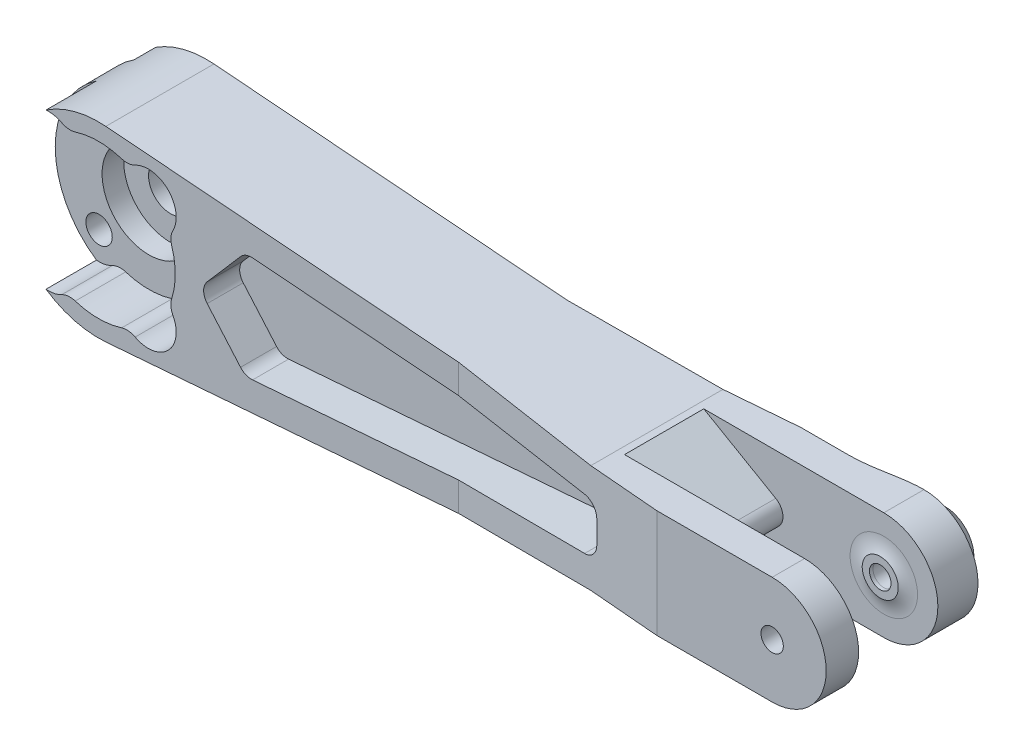
from build123d import *

# Parameters (mm, degrees)
SKETCH2_R               = 13
SKETCH2_R_2             = 7.5
BOSS_EXTRUDE2_DEPTH     = 10
CUT_EXTRUDE1_DEPTH      = 105.791459576
CUT_EXTRUDE1_DEPTH_BACK = 105.791459576
SKETCH5_R               = 1.83
SKETCH5_R_2             = 3.05
CUT_EXTRUDE2_DEPTH      = 106.770979007
HUB_CUTOUT_DEPTH        = 7
SKETCH8_R               = 6.5
CUT_EXTRUDE4_DEPTH      = 3
CUT_EXTRUDE5_DEPTH      = 105.791459576
CUT_EXTRUDE5_DEPTH_BACK = 105.791459576
SKETCH9_R               = 1.55
CUT_EXTRUDE6_DEPTH      = 5.5
FILLET1_R               = 2
CUT_EXTRUDE7_START      = 2.5
CUT_EXTRUDE7_DEPTH      = 103.291459576
FILLET2_R               = 2
FILLET2_OF_MIRROR1_R    = 2
SKETCH12_R              = 4
SKETCH12_R_2            = 1.55
BOSS_EXTRUDE3_DEPTH     = 4
FILLET3_START           = -14
FILLET3_2_DEPTH         = 4
BOSS_EXTRUDE4_START     = 5.5
SKETCH13_R              = 2.5
SKETCH13_R_2            = 1.5
BOSS_EXTRUDE4_DEPTH     = 0.5
BOSS_EXTRUDE5_START     = -5
SKETCH13_2_R            = 2.5
SKETCH13_2_R_2          = 1.5
BOSS_EXTRUDE5_DEPTH     = 0.5
FILLET4_R               = 5
SKETCH15_R              = 4
CUT_EXTRUDE8_DEPTH      = 3


with BuildPart() as part:
    # Sketch2 → Boss-Extrude2 (new, symmetric)
    with BuildSketch(Plane.XY):
        Circle(SKETCH2_R)
        with BuildLine():
            Line((70, 7.5), (1.025771359, 12.959467316))
            ThreePointArc((1.025771359, 12.959467316), (9.548168088, 8.822272166), (13, 0))
            ThreePointArc((13, 0), (9.548168088, -8.822272166), (1.025771359, -12.959467316))
            Line((1.025771359, -12.959467316), (70, -7.5))
            Line((70, -7.5), (70, 7.5))
        make_face()
        with BuildLine():
            Line((96, 7.5), (70, 7.5))
            Line((70, 7.5), (70, -7.5))
            Line((70, -7.5), (96, -7.5))
            ThreePointArc((96, -7.5), (88.5, 0), (96, 7.5))
        make_face()
        with Locations((96, 0)):
            Circle(SKETCH2_R_2)
        Circle(SKETCH2_R)
    extrude(amount=BOSS_EXTRUDE2_DEPTH, both=True)

    # Sketch4 → Cut-Extrude1 (cut, two sides: drawn at the far end of the back side and taken through both)
    with BuildSketch(Plane(origin=(0, 0, 0), x_dir=(1, 0, 0), z_dir=(0, 1, 0)).offset(-CUT_EXTRUDE1_DEPTH_BACK)):
        Polygon((-13, 7.5), (50, 7.5), (80, 10), (-13, 10), align=None)
        Polygon((-13, -7.5), (50, -7.5), (80, -10), (-13, -10), align=None)
    extrude(amount=CUT_EXTRUDE1_DEPTH + CUT_EXTRUDE1_DEPTH_BACK, mode=Mode.SUBTRACT)

    # Sketch5 → Cut-Extrude2 (cut, through all)
    with BuildSketch(Plane.XY.offset(7.5)):
        with Locations((-6.914797213, 6.914797213)):
            Circle(SKETCH5_R)
        with Locations((6.914797213, 6.914797213)):
            Circle(SKETCH5_R)
        with Locations((6.914797213, -6.914797213)):
            Circle(SKETCH5_R)
        with Locations((-6.914797213, -6.914797213)):
            Circle(SKETCH5_R)
        Circle(SKETCH5_R_2)
    extrude(amount=-CUT_EXTRUDE2_DEPTH, mode=Mode.SUBTRACT)

    # Sketch7 → hub cutout (cut)
    with BuildSketch(Plane.XY.offset(7.5)):
        with BuildLine():
            ThreePointArc((-7.281143007, 10.769631215), (-13, 0), (-7.281143007, -10.769631215))
            ThreePointArc((-7.281143007, -10.769631215), (-6.15529138, -10.711783559), (-5.093815501, -10.332103173))
            ThreePointArc((-5.093815501, -10.332103173), (-4.17580433, -10.057753531), (-3.223255475, -10.161014917))
            ThreePointArc((-3.223255475, -10.161014917), (0, -10.66), (3.223255475, -10.161014917))
            ThreePointArc((3.223255475, -10.161014917), (4.17580433, -10.057753531), (5.093815501, -10.332103173))
            ThreePointArc((5.093815501, -10.332103173), (9.652858062, -9.652858062), (10.332103173, -5.093815501))
            ThreePointArc((10.332103173, -5.093815501), (10.057753531, -4.17580433), (10.161014917, -3.223255475))
            ThreePointArc((10.161014917, -3.223255475), (10.66, 0), (10.161014917, 3.223255475))
            ThreePointArc((10.161014917, 3.223255475), (10.057753531, 4.17580433), (10.332103173, 5.093815501))
            ThreePointArc((10.332103173, 5.093815501), (9.652858062, 9.652858062), (5.093815501, 10.332103173))
            ThreePointArc((5.093815501, 10.332103173), (4.17580433, 10.057753531), (3.223255475, 10.161014917))
            ThreePointArc((3.223255475, 10.161014917), (0, 10.66), (-3.223255475, 10.161014917))
            ThreePointArc((-3.223255475, 10.161014917), (-4.17580433, 10.057753531), (-5.093815501, 10.332103173))
            ThreePointArc((-5.093815501, 10.332103173), (-6.15529138, 10.711783559), (-7.281143007, 10.769631215))
        make_face()
    extrude(amount=-HUB_CUTOUT_DEPTH, mode=Mode.SUBTRACT)

    # Sketch8 → Cut-Extrude4 (cut)
    with BuildSketch(Plane.XY.offset(0.5)):
        Circle(SKETCH8_R)
    extrude(amount=-CUT_EXTRUDE4_DEPTH, mode=Mode.SUBTRACT)

    # Sketch9 → Cut-Extrude5 (cut, two sides: drawn at the far end of the back side and taken through both)
    with BuildSketch(Plane.XY.offset(-CUT_EXTRUDE5_DEPTH_BACK)):
        with Locations((96, 0)):
            Circle(SKETCH9_R)
    extrude(amount=CUT_EXTRUDE5_DEPTH + CUT_EXTRUDE5_DEPTH_BACK, mode=Mode.SUBTRACT)

    # Sketch10 → Cut-Extrude6 (cut, symmetric)
    with BuildSketch(Plane.XY):
        Polygon((84, 0), (62.184725581, 12.595054558), (110.068063566, 12.595054558), (110.068063566, -12.520209035), (62.31436183, -12.520209035), align=None)
    extrude(amount=CUT_EXTRUDE6_DEPTH, both=True, mode=Mode.SUBTRACT)

    # Fillet1
    fillet1_edges = [part.edges().sort_by_distance(p)[0] for p in [
        (84, 0, 0),
    ]]
    fillet(fillet1_edges, radius=FILLET1_R)

    # Sketch11 → Cut-Extrude7 (cut, through all)
    with BuildSketch(Plane.XY.offset(CUT_EXTRUDE7_START)):
        Polygon((13.951045221, 0), (20.381756661, 7.414886386), (70.904413477, 3.415903011), (70.904413477, 0), (70.904413477, -3.415903011), (20.381756661, -7.414886386), align=None)
    cut_extrude7 = extrude(amount=CUT_EXTRUDE7_DEPTH, mode=Mode.SUBTRACT)

    # Fillet2
    fillet2_edges = [part.edges().sort_by_distance(p)[0] for p in [
        (13.951045221, 0, 5),
        (20.381756661, 7.414886386, 5),
        (20.381756661, -7.414886386, 5),
        (70.904413477, -3.415903011, 5.871017228),
        (70.904413477, 3.415903011, 5.871017228),
    ]]
    fillet(fillet2_edges, radius=FILLET2_R)

    # Mirror1: Cut-Extrude7 across plane
    add(cut_extrude7.mirror(Plane.XY), mode=Mode.SUBTRACT)

    # Fillet2 of Mirror1
    fillet2_of_mirror1_edges = [part.edges().sort_by_distance(p)[0] for p in [
        (13.951045221, 0, -5),
        (20.381756661, 7.414886386, -5),
        (20.381756661, -7.414886386, -5),
        (70.904413477, -3.415903011, -5.871017228),
        (70.904413477, 3.415903011, -5.871017228),
    ]]
    fillet(fillet2_of_mirror1_edges, radius=FILLET2_OF_MIRROR1_R)

    # Sketch12 → Boss-Extrude3 (add)
    with BuildSketch(Plane(origin=(0, 0, -10), x_dir=(-1, 0, 0), z_dir=(0, 0, -1))):
        with Locations(Location((-96, 0, 0), (0, 0, 180))):
            Circle(SKETCH12_R)
        with Locations(Location((-96, 0, 0), (0, 0, 180))):
            Circle(SKETCH12_R_2, mode=Mode.SUBTRACT)
    extrude(amount=BOSS_EXTRUDE3_DEPTH)

    # Fillet3: read off the stored shape, not the designer's step
    # Fillet3 outline → Fillet3 (revolve)
    with BuildSketch(Plane(origin=(96, 0, 0), x_dir=(1, 0, 0), z_dir=(0, -1, 0))):
        with BuildLine():
            ThreePointArc((4, -14), (7.527864045, -11.05572809), (12, -10))
            Line((12, -10), (4, -10))
            Line((4, -10), (4, -14))
        make_face()
    revolve(axis=Axis((96, 0, 0), (0, 0, 1)))

    # Fillet3 2 outline → Fillet3 2 (cut)
    with BuildSketch(Plane.XY.offset(FILLET3_START)):
        with BuildLine():
            ThreePointArc((96, 7.5), (103.5, 0), (96, -7.5))
            Line((96, -7.5), (85, -7.5))
            Line((85, -7.5), (85, -13))
            Line((85, -13), (109, -13))
            Line((109, -13), (109, 13))
            Line((109, 13), (85, 13))
            Line((85, 13), (85, 7.5))
            Line((85, 7.5), (96, 7.5))
        make_face()
    extrude(amount=FILLET3_2_DEPTH, mode=Mode.SUBTRACT)

    # Sketch13 → Boss-Extrude4 (add)
    with BuildSketch(Plane.XY.offset(BOSS_EXTRUDE4_START)):
        with Locations((96, 0)):
            Circle(SKETCH13_R)
        with Locations((96, 0)):
            Circle(SKETCH13_R_2, mode=Mode.SUBTRACT)
    extrude(amount=-BOSS_EXTRUDE4_DEPTH)

    # Sketch13<2> → Boss-Extrude5 (add)
    with BuildSketch(Plane.XY.offset(BOSS_EXTRUDE5_START)):
        with Locations((96, 0)):
            Circle(SKETCH13_2_R)
        with Locations((96, 0)):
            Circle(SKETCH13_2_R_2, mode=Mode.SUBTRACT)
    extrude(amount=-BOSS_EXTRUDE5_DEPTH)

    # Fillet4
    # the kernel refuses this fillet: 5 mm, written as the material it adds along each edge
    with BuildSketch(Plane(origin=(96, 0, 5.5), x_dir=(1, 0, 0), z_dir=(0, -1, 0))) as fillet4_piece_1:
        with BuildLine():
            CenterArc((4.679449472, -5), FILLET4_R, 90, 25.841932763)
            Line((2.5, -0.5), (2.456411011, -0.41))
            ThreePointArc((2.456411011, -0.41), (2.4, -0.25), (2.4, 0))
            Line((2.4, 0), (2.5, 0.1))
            Line((2.5, 0.1), (4.679449472, 0.1))
            Line((4.679449472, 0.1), (4.679449472, 0))
        make_face()
    revolve(axis=Axis((96, 0, 5.5), (0, 0, 1)))
    with BuildSketch(Plane(origin=(96, 0, -5.5), x_dir=(1, 0, 0), z_dir=(0, -1, 0))) as fillet4_piece_2:
        with BuildLine():
            CenterArc((4.679449472, 5), FILLET4_R, 244.158067237, 25.841932763)
            Line((2.5, 0.5), (2.456411011, 0.41))
            ThreePointArc((2.456411011, 0.41), (2.4, 0.25), (2.4, 0))
            Line((2.4, 0), (2.5, -0.1))
            Line((2.5, -0.1), (4.679449472, -0.1))
            Line((4.679449472, -0.1), (4.679449472, 0))
        make_face()
    revolve(axis=Axis((96, 0, -5.5), (0, 0, 1)))

    # Sketch15 → Cut-Extrude8 (cut)
    with BuildSketch(Plane(origin=(0, 0, -7.5), x_dir=(-1, 0, 0), z_dir=(0, 0, -1))):
        with Locations((6.914797213, -6.914797213)):
            Circle(SKETCH15_R)
        with Locations((-6.914797213, -6.914797213)):
            Circle(SKETCH15_R)
        with Locations((6.914797213, 6.914797213)):
            Circle(SKETCH15_R)
        with Locations((-6.914797213, 6.914797213)):
            Circle(SKETCH15_R)
    extrude(amount=-CUT_EXTRUDE8_DEPTH, mode=Mode.SUBTRACT)


solid = part.part
